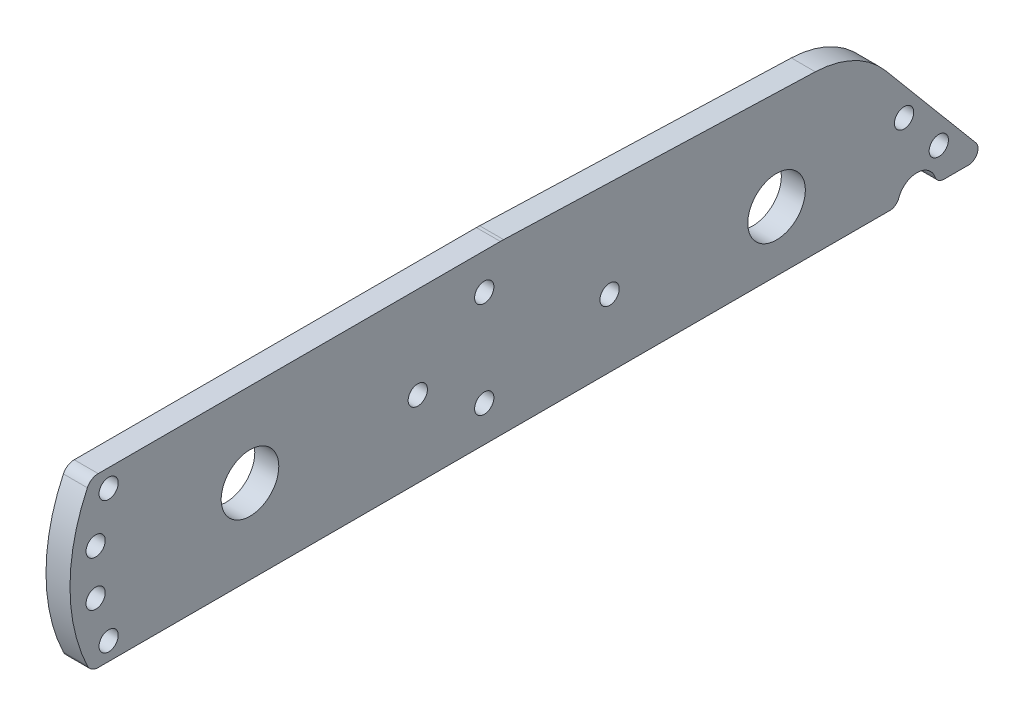
from build123d import *

# Parameters (mm, degrees)
STOCK_HAMMERSAW_START                   = -149.225
STOCK_HAMMERSAW_MULTIBODY_1_OUTLINE_R   = 2.5527
STOCK_HAMMERSAW_MULTIBODY_1_OUTLINE_R_2 = 7.62
STOCK_HAMMERSAW_MULTIBODY_1_OUTLINE_R_3 = 2.54
STOCK_HAMMERSAW_MULTIBODY_1_DEPTH       = 9.525
FILLET1_R                               = 2.54
FILLET2_R                               = 3.175
FILLET3_R                               = 25.4
FILLET4_R                               = 2.54
CUT_EXTRUDE1_DEPTH                      = 201.10578904
CUT_EXTRUDE1_DEPTH_BACK                 = 201.10578904
SKETCH1_W                               = 1.5875
SKETCH1_H                               = 240.255072357


with BuildPart() as part:
    # Stock-HammerSaw Multibody-1: read off the stored shape, not the designer's step
    # Stock-HammerSaw Multibody-1 outline → Stock-HammerSaw Multibody-1 (new body)
    with BuildSketch(Plane.YZ.offset(STOCK_HAMMERSAW_START)):
        with BuildLine():
            Line((9.525, 42.121134838), (9.525, -171.391646474))
            ThreePointArc((9.525, -171.391646474), (14.605, -176.471646474), (9.525, -181.551646474))
            Line((9.525, -181.551646474), (9.525, -195.537119935))
            Line((9.525, -195.537119935), (50.8, -160.903282658))
            Line((50.8, -160.903282658), (53.975, -66.675))
            Line((53.975, -66.675), (53.975, 42.121134838))
            ThreePointArc((53.975, 42.121134838), (31.75, 47.625), (9.525, 42.121134838))
        make_face()
        with Locations((17.944382949, -182.255416592)):
            Circle(STOCK_HAMMERSAW_MULTIBODY_1_OUTLINE_R, mode=Mode.SUBTRACT)
        with Locations((28.88924293, -173.071588618)):
            Circle(STOCK_HAMMERSAW_MULTIBODY_1_OUTLINE_R, mode=Mode.SUBTRACT)
        with Locations((25.4, -139.326770285)):
            Circle(STOCK_HAMMERSAW_MULTIBODY_1_OUTLINE_R_2, mode=Mode.SUBTRACT)
        with Locations((27.413358223, -95.151227202)):
            Circle(STOCK_HAMMERSAW_MULTIBODY_1_OUTLINE_R, mode=Mode.SUBTRACT)
        with Locations((19.05, -61.986201926)):
            Circle(STOCK_HAMMERSAW_MULTIBODY_1_OUTLINE_R, mode=Mode.SUBTRACT)
        with Locations((29.726233837, -44.403906028)):
            Circle(STOCK_HAMMERSAW_MULTIBODY_1_OUTLINE_R, mode=Mode.SUBTRACT)
        with Locations((14.2875, 37.399020291)):
            Circle(STOCK_HAMMERSAW_MULTIBODY_1_OUTLINE_R_3, mode=Mode.SUBTRACT)
        with Locations((25.761047521, 40.838193804)):
            Circle(STOCK_HAMMERSAW_MULTIBODY_1_OUTLINE_R_3, mode=Mode.SUBTRACT)
        with Locations((44.45, -61.986201926)):
            Circle(STOCK_HAMMERSAW_MULTIBODY_1_OUTLINE_R, mode=Mode.SUBTRACT)
        with Locations((31.75, 0)):
            Circle(STOCK_HAMMERSAW_MULTIBODY_1_OUTLINE_R_2, mode=Mode.SUBTRACT)
        with Locations((37.738952479, 40.838193804)):
            Circle(STOCK_HAMMERSAW_MULTIBODY_1_OUTLINE_R_3, mode=Mode.SUBTRACT)
        with Locations((49.2125, 37.399020291)):
            Circle(STOCK_HAMMERSAW_MULTIBODY_1_OUTLINE_R_3, mode=Mode.SUBTRACT)
    extrude(amount=STOCK_HAMMERSAW_MULTIBODY_1_DEPTH)


with BuildPart() as part_1:
    # Body-Move/Copy2: read off the stored shape, not the designer's step
    # Body-Move/Copy2: moved
    add(part.part.moved(Location((144.4625, 0, 0))))

    # Fillet1
    fillet1_edges = [part_1.edges().sort_by_distance(p)[0] for p in [
        (0, 9.525, -195.537119935),
    ]]
    fillet(fillet1_edges, radius=FILLET1_R)

    # Fillet2
    fillet2_edges = [part_1.edges().sort_by_distance(p)[0] for p in [
        (0, 53.975, 42.121134838),
        (0, 9.525, 42.121134838),
    ]]
    fillet(fillet2_edges, radius=FILLET2_R)

    # Fillet3
    # the kernel refuses this fillet: 25.4 mm, written as the material it takes off along each edge
    with BuildSketch(Plane(origin=(-33.08112114, 50.8, -160.903282658), x_dir=(0, -0.7660444431175363, -0.6427876096882575), z_dir=(1, 0, 0))) as fillet3_piece_1:
        with BuildLine():
            CenterArc((FILLET3_R * 0.445962537632, -FILLET3_R), FILLET3_R, 90, 48.070162195)
            Line((-FILLET3_R * 0.2980011219, -FILLET3_R * 0.33177992151), (0, 0))
            Line((0, 0), (FILLET3_R * 0.445962537632, 0))
        make_face()
    extrude(amount=66.162242279, mode=Mode.SUBTRACT)
    with BuildSketch(Plane(origin=(-5.832005366, 53.975, -66.675), x_dir=(0, 0, 1), z_dir=(1, 0, 0))) as fillet3_piece_2:
        with BuildLine():
            CenterArc((FILLET3_R * 0.0168426041932, FILLET3_R), FILLET3_R, 268.070162195, 1.929837805)
            Line((-FILLET3_R * 0.0168330513083, FILLET3_R * 0.000567185736557), (0, 0))
            Line((0, 0), (FILLET3_R * 0.0168426041932, 0))
        make_face()
    extrude(amount=11.664010733, mode=Mode.SUBTRACT)

    # Fillet4
    fillet4_edges = [part_1.edges().sort_by_distance(p)[0] for p in [
        (0, 9.525, -181.551646474),
        (0, 9.525, -171.391646474),
    ]]
    fillet(fillet4_edges, radius=FILLET4_R)

    # Sketch1 → Cut-Extrude1 (cut, two sides: drawn at the far end of the back side and taken through both)
    with BuildSketch(Plane(origin=(0, 0, 0), x_dir=(1, 0, 0), z_dir=(0, 1, 0)).offset(-CUT_EXTRUDE1_DEPTH_BACK)):
        with Locations((-3.96875, 72.502536179)):
            Rectangle(SKETCH1_W, SKETCH1_H)
        with Locations((3.96875, 72.502536179)):
            Rectangle(SKETCH1_W, SKETCH1_H)
    extrude(amount=CUT_EXTRUDE1_DEPTH + CUT_EXTRUDE1_DEPTH_BACK, mode=Mode.SUBTRACT)


solid = part_1.part
